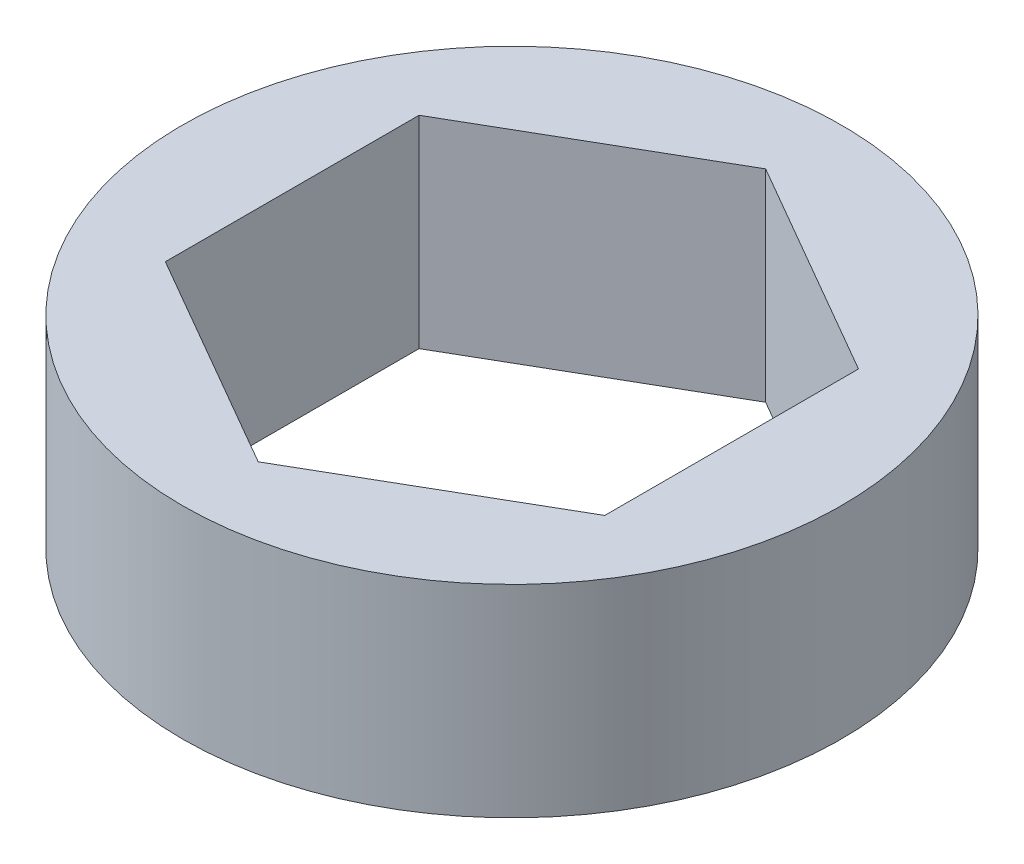
from build123d import *

# Parameters (mm, degrees)
SKETCH1_R           = 9.525
BOSS_EXTRUDE1_DEPTH = 5.842


with BuildPart() as part:
    # Sketch1 → Boss-Extrude1 (new body)
    with BuildSketch(Plane(origin=(0, 0, 0), x_dir=(1, 0, 0), z_dir=(0, 1, 0))):
        Circle(SKETCH1_R)
        Polygon((0, 7.332348419), (-6.35, 3.666174209), (-6.35, -3.666174209), (0, -7.332348419), (6.35, -3.666174209), (6.35, 3.666174209), align=None, mode=Mode.SUBTRACT)
    extrude(amount=BOSS_EXTRUDE1_DEPTH)


solid = part.part
